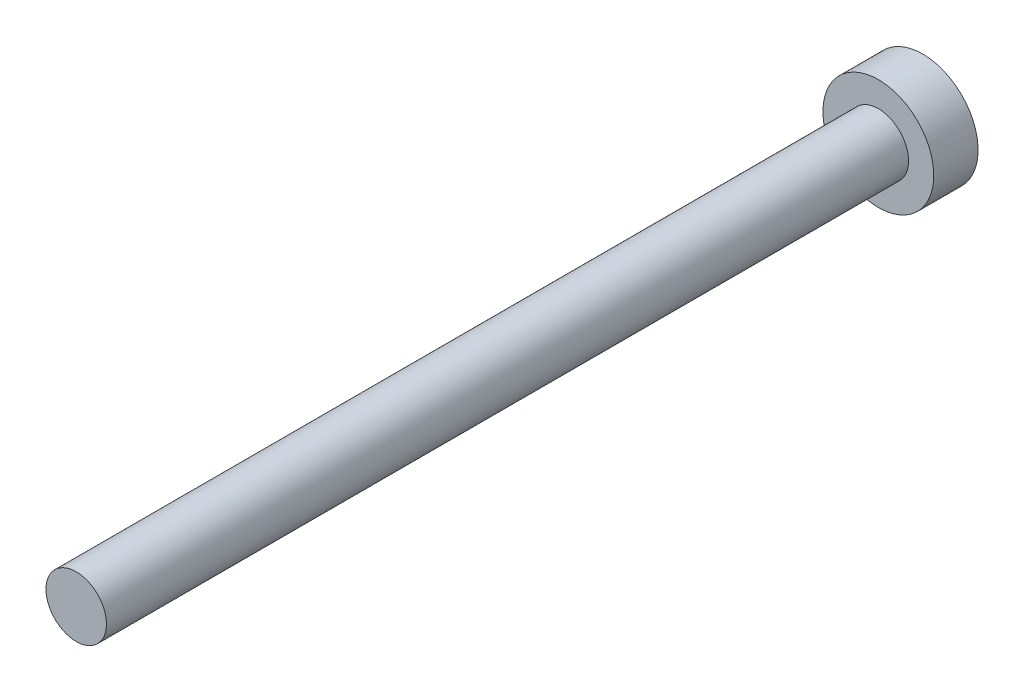
from build123d import *

# Parameters (mm, degrees)
SKETCH1_R           = 1.5
BOSS_EXTRUDE1_DEPTH = 42
SKETCH2_R           = 2.75
BOSS_EXTRUDE2_DEPTH = 2.2
ESCALA1_SCALE       = 1.5


with BuildPart() as part:
    # Sketch1 → Boss-Extrude1 (new body)
    with BuildSketch(Plane.XY):
        Circle(SKETCH1_R)
    extrude(amount=BOSS_EXTRUDE1_DEPTH)

    # Sketch2 → Boss-Extrude2 (add)
    with BuildSketch(Plane(origin=(0, 0, 0), x_dir=(-1, 0, 0), z_dir=(0, 0, -1))):
        Circle(SKETCH2_R)
    extrude(amount=-BOSS_EXTRUDE2_DEPTH)


with BuildPart() as part_1:
    # Escala1: scaled about (0, 0, 0)
    add(part.part.scale(ESCALA1_SCALE))


solid = part_1.part
